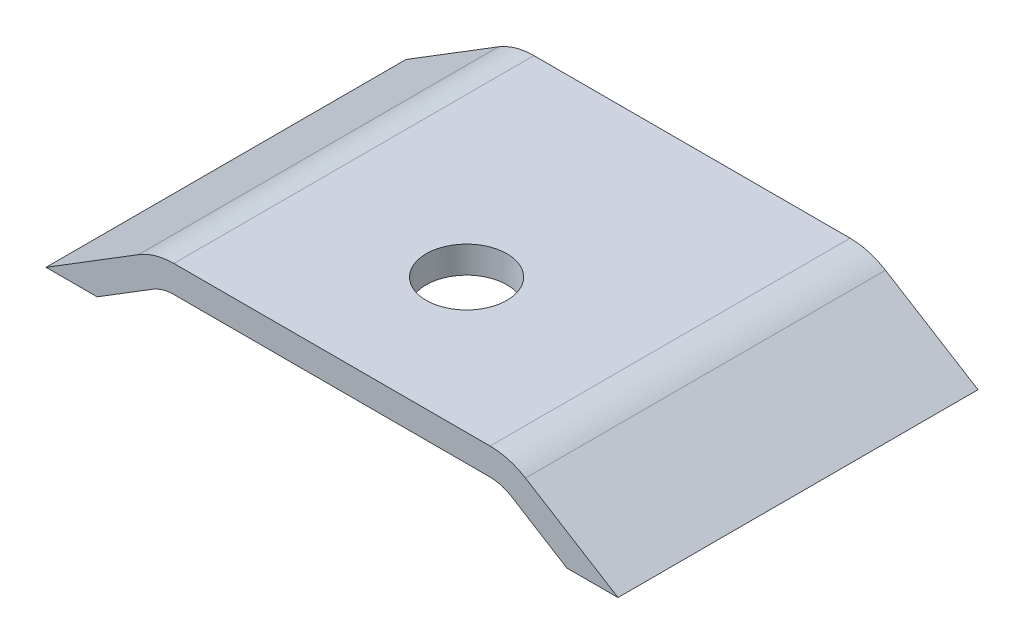
from build123d import *

# Parameters (mm, degrees)
BOSS_EXTRUDE1_DEPTH = 67.945
FILLET1_R           = 12.7
CUT_EXTRUDE1_REACH  = 89.007
CUT_EXTRUDE2_REACH  = 89.699
SKETCH5_R           = 7.62


with BuildPart() as part:
    # Sketch1 → Boss-Extrude1 (new body)
    with BuildSketch(Plane.XY):
        Polygon((-53.975, -6.35), (-33.449406604, 6.35), (33.449406604, 6.35), (53.975, -6.35), align=None)
    extrude(amount=BOSS_EXTRUDE1_DEPTH)

    # Fillet1
    fillet1_edges = [part.edges().sort_by_distance(p)[0] for p in [
        (-33.449406604, 6.35, 33.9725),
        (33.449406604, 6.35, 33.9725),
    ]]
    fillet(fillet1_edges, radius=FILLET1_R)

    # Sketch3 → Cut-Extrude1 (cut, up to next)
    with BuildSketch(Plane.XY.offset(67.945), mode=Mode.PRIVATE) as cut_extrude1_sk1:
        with BuildLine():
            Line((-51.302080212, -10.669942107), (51.302080212, -10.669942107))
            Line((51.302080212, -10.669942107), (33.847478799, 0.12991316))
            ThreePointArc((33.847478799, 0.12991316), (31.922261025, 0.979438528), (29.838099116, 1.27))
            Line((29.838099116, 1.27), (-29.838099116, 1.27))
            ThreePointArc((-29.838099116, 1.27), (-31.922261025, 0.979438528), (-33.847478799, 0.12991316))
            Line((-33.847478799, 0.12991316), (-51.302080212, -10.669942107))
        make_face()
    cut_extrude1_tool1 = extrude(cut_extrude1_sk1.sketch, amount=-CUT_EXTRUDE1_REACH, mode=Mode.PRIVATE) & part.part
    add(cut_extrude1_tool1.solids().sort_by_distance((0, -5.166229, 67.945))[0], mode=Mode.SUBTRACT)

    # Sketch5 → Cut-Extrude2 (cut, up to next)
    with BuildSketch(Plane(origin=(0, 6.35, 0), x_dir=(1, 0, 0), z_dir=(0, 1, 0)), mode=Mode.PRIVATE) as cut_extrude2_sk1:
        with Locations((0, -42.545)):
            Circle(SKETCH5_R)
    cut_extrude2_tool1 = extrude(cut_extrude2_sk1.sketch, amount=-CUT_EXTRUDE2_REACH, mode=Mode.PRIVATE) & part.part
    add(cut_extrude2_tool1.solids().sort_by_distance((0, 6.35, 42.545))[0], mode=Mode.SUBTRACT)


solid = part.part
